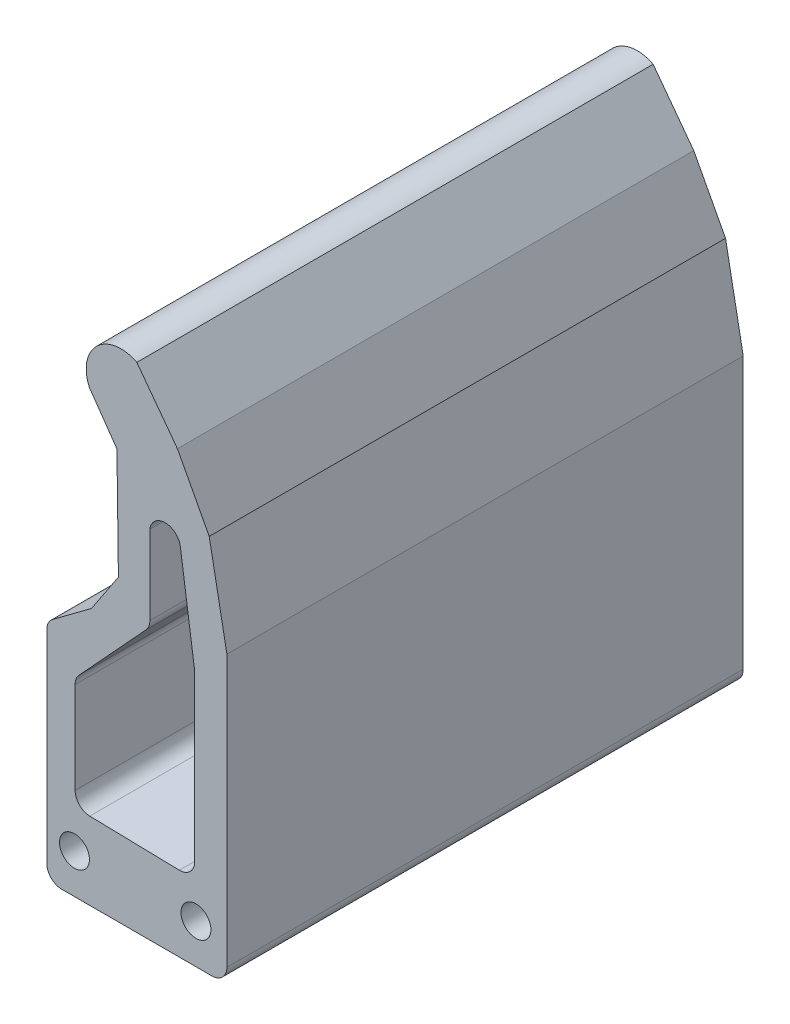
from build123d import *

# Parameters (mm, degrees)
BOSS_EXTRUDE1_DEPTH = 34.5
FILLET1_R           = 1
SKETCH2_R           = 1
CUT_EXTRUDE1_DEPTH  = 496.614236654


with BuildPart() as part:
    # Sketch1 → Boss-Extrude1 (new body)
    with BuildSketch(Plane.XY.offset(40)):
        with BuildLine():
            Line((-312.030492528, 377.868524993), (-310.193868717, 375.244776692))
            Line((-310.193868717, 375.244776692), (-310.096008301, 367.875213623))
            Line((-310.096008301, 367.875213623), (-311.889068604, 365.166412354))
            Line((-311.889068604, 365.166412354), (-314.88168335, 362.936676025))
            Line((-314.88168335, 362.936676025), (-314.88168335, 347.918438133))
            Line((-314.88168335, 347.918438133), (-302.847373473, 347.918438133))
            Line((-302.847373473, 347.918438133), (-302.847373473, 367.04556325))
            Line((-302.847373473, 367.04556325), (-304.028060208, 373.263846724))
            Line((-304.028060208, 373.263846724), (-306.153296332, 377.278181625))
            Line((-306.153296332, 377.278181625), (-308.864528411, 380.917030307))
            ThreePointArc((-308.864528411, 380.917030307), (-311.535911341, 380.523114569), (-312.030492528, 377.868524993))
        make_face()
        with BuildLine():
            Line((-312.988408734, 360.598376943), (-312.988408734, 353.109979303))
            Line((-312.988408734, 353.109979303), (-305, 352.927314193))
            Line((-305, 352.927314193), (-305, 365))
            Line((-305, 365), (-305.952850342, 371.670013428))
            ThreePointArc((-305.952850342, 371.670013428), (-306.959348498, 372.584855641), (-307.99460106, 371.702683918))
            Line((-307.99460106, 371.702683918), (-307.99460106, 366.023339102))
            Line((-307.99460106, 366.023339102), (-312.988408734, 360.598376943))
        make_face(mode=Mode.SUBTRACT)
    extrude(amount=BOSS_EXTRUDE1_DEPTH)

    # Fillet1
    fillet1_edges = [part.edges().sort_by_distance(p)[0] for p in [
        (-314.88168335, 347.918438133, 57.25),
        (-305, 352.927314193, 57.25),
        (-302.847373473, 347.918438133, 57.25),
        (-312.988408734, 353.109979303, 57.25),
        (-314.88168335, 362.936676025, 57.25),
        (-312.988408734, 360.598376943, 57.25),
        (-307.99460106, 366.023339102, 57.25),
    ]]
    fillet(fillet1_edges, radius=FILLET1_R)

    # Sketch2 → Cut-Extrude1 (cut, through all)
    with BuildSketch(Plane.XY.offset(74.5)):
        with Locations((-313.031111026, 350.560286037)):
            Circle(SKETCH2_R)
        with Locations((-304.91451991, 350.560286037)):
            Circle(SKETCH2_R)
    extrude(amount=-CUT_EXTRUDE1_DEPTH, mode=Mode.SUBTRACT)


solid = part.part
